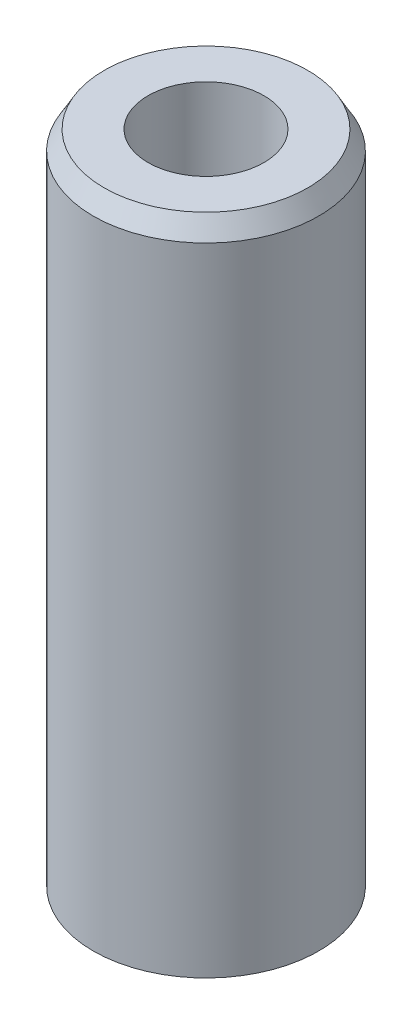
from build123d import *
from OCP.BRepFilletAPI import BRepFilletAPI_MakeChamfer

# Parameters (mm, degrees)
SKETCH1_R           = 10
BOSS_EXTRUDE1_DEPTH = 59.104148748
SKETCH2_R           = 5.143372621
CUT_EXTRUDE1_DEPTH  = 61.772529972
CHAMFER1_SIZE       = 1.681316577
CHAMFER1_SIZE2      = 0.970708578


with BuildPart() as part:
    # Sketch1 → Boss-Extrude1 (new body)
    with BuildSketch(Plane(origin=(0, 0, 0), x_dir=(1, 0, 0), z_dir=(0, 1, 0))):
        Circle(SKETCH1_R)
    extrude(amount=BOSS_EXTRUDE1_DEPTH)

    # Sketch2 → Cut-Extrude1 (cut, through all)
    with BuildSketch(Plane(origin=(0, 0, 0), x_dir=(1, 0, 0), z_dir=(0, 1, 0))):
        Circle(SKETCH2_R)
    extrude(amount=CUT_EXTRUDE1_DEPTH, mode=Mode.SUBTRACT)

    # Chamfer1: one chamfer whose edges measure the first distance from different faces: ONE call of the kernel's chamfer builder (chamfer() names one face for all edges)
    chamfer1_edges_1 = [part.edges().sort_by_distance(p)[0] for p in [
        (-10, 59.104148748, 0),
    ]]
    chamfer1_side_1 = [part.faces().sort_by_distance(p)[0] for p in [
        (-10, 29.552074374, 0),
    ]]
    chamfer1_edges_2 = [part.edges().sort_by_distance(p)[0] for p in [
        (-10, 0, 0),
    ]]
    chamfer1_side_2 = [part.faces().sort_by_distance(p)[0] for p in [
        (-9.717157288, 0, 0),
    ]]
    chamfer1 = BRepFilletAPI_MakeChamfer(part.part.solid().wrapped)
    for e in chamfer1_edges_1:
        chamfer1.Add(CHAMFER1_SIZE, CHAMFER1_SIZE2, e.wrapped, chamfer1_side_1[0].wrapped)  # the first distance lies on this face
    for e in chamfer1_edges_2:
        chamfer1.Add(CHAMFER1_SIZE, CHAMFER1_SIZE2, e.wrapped, chamfer1_side_2[0].wrapped)  # the first distance lies on this face
    add(Compound.cast(chamfer1.Shape()), mode=Mode.REPLACE)


solid = part.part
